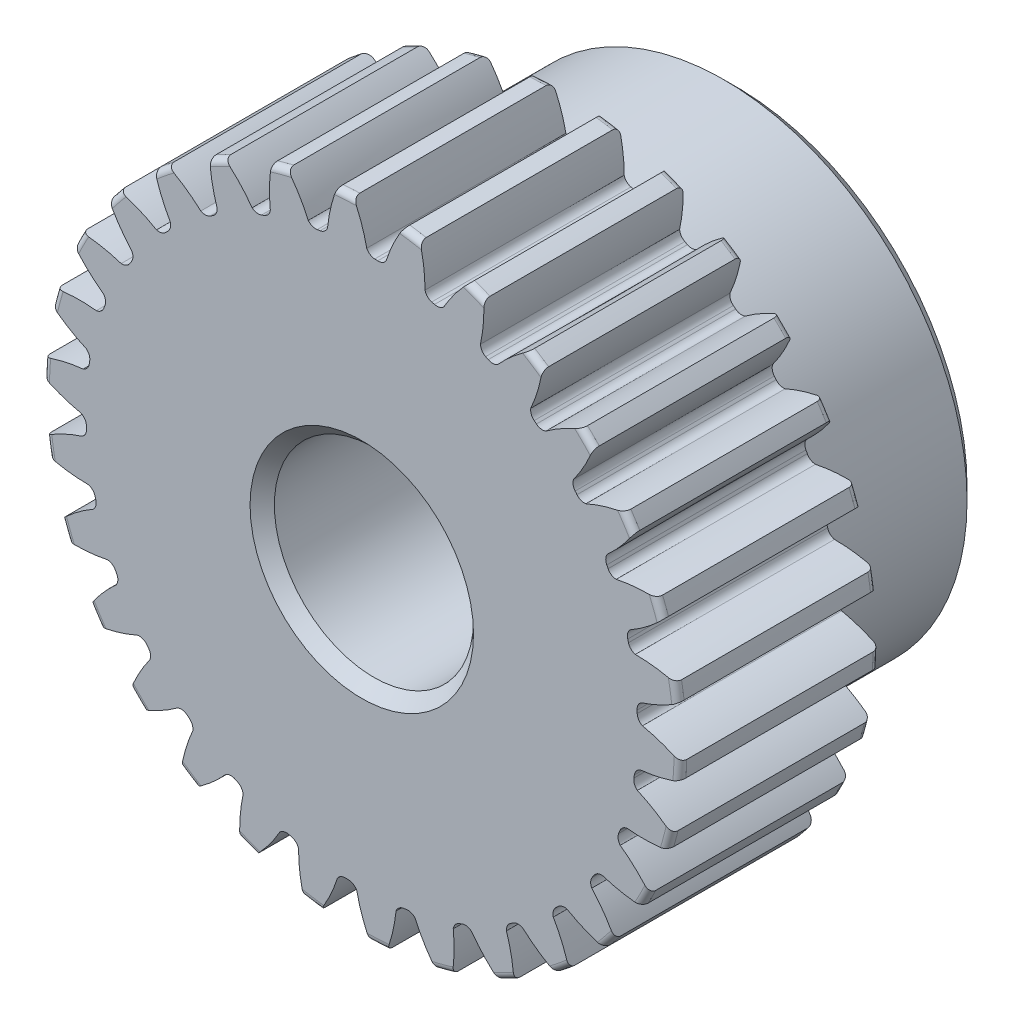
from build123d import *

# Parameters (mm, degrees)
SKETCH1_R                = 20.32
BOSS_EXTRUDE1_DEPTH      = 12.7
SKETCH2_W                = 11.176
SKETCH2_H                = 15.494
FILLET2_R                = 0.4064
CUT_EXTRUDE1_DEPTH       = 38.361319303
FILLET1_R                = 0.5984748
CIRPATTERN1_COUNT        = 30
FILLET1_OF_CIRPATTERN1_R = 0.5984748
SKETCH5_R                = 6.35
CUT_EXTRUDE2_DEPTH       = 38.353644107
CHAMFER1_SIZE            = 0.7747


with BuildPart() as part:
    # Sketch1 → Boss-Extrude1 (new body)
    with BuildSketch(Plane.XY):
        Circle(SKETCH1_R)
    extrude(amount=-BOSS_EXTRUDE1_DEPTH)

    # Sketch2 → Revolve1 (revolve)
    with BuildSketch(Plane(origin=(0, 0, 0), x_dir=(0, 0, -1), z_dir=(1, 0, 0)), mode=Mode.PRIVATE) as revolve1_sk:
        with Locations((18.288, 7.747)):
            Rectangle(SKETCH2_W, SKETCH2_H)
    revolve(revolve1_sk.sketch.rotate(Axis((0, 0, -12.7), (0, 0, -1)), 90), axis=Axis((0, 0, -12.7), (0, 0, -1)))

    # Fillet2
    fillet2_edges = [part.edges().sort_by_distance(p)[0] for p in [
        (-20.32, 0, 0),
        (-20.32, 0, -12.7),
        (-15.494, 0, -12.7),
    ]]
    fillet(fillet2_edges, radius=FILLET2_R)

    # Sketch4 → Cut-Extrude1 (cut, through all)
    with BuildSketch(Plane.XY):
        with BuildLine():
            Line((0.316235248, 17.898350958), (0.316235248, 17.577765593))
            ThreePointArc((0.316235248, 17.577765593), (0.920100185, 17.556516272), (1.522878236, 17.514527965))
            Line((1.522878236, 17.514527965), (1.556388609, 17.833357122))
            add(Edge.make_bspline(
                [(7.60274721, 24.159654156), (2.923261273, 22.051641148), (1.556388609, 17.833357122)],
                knots=[0, 0, 0, 1, 1, 1], degree=2))
            ThreePointArc((7.60274721, 24.159654156), (1.325550705, 25.292954936), (-5.035720965, 24.822009758))
            add(Edge.make_bspline(
                [(-5.035720965, 24.822009758), (-0.602217735, 22.236404106), (0.316235248, 17.898350958)],
                knots=[0, 0, 0, 1, 1, 1], degree=2))
        make_face()
    cut_extrude1 = extrude(amount=-CUT_EXTRUDE1_DEPTH, mode=Mode.SUBTRACT)

    # Fillet1
    # the kernel refuses this fillet: 0.5984748 mm, written as the material it adds along each edge
    with BuildSketch(Plane(origin=(1.522878236, 17.514527965, 0), x_dir=(0.10452870680651095, 0.9945218697712779, 0), z_dir=(0, 0, -1))) as fillet1_piece_1:
        with BuildLine():
            CenterArc((0.581202596, -0.538749242), FILLET1_R, 115.815141676, 61.489173657)
            Line((-0.016609944, -0.510602243), (-0.028566195, -0.510039303))
            ThreePointArc((-0.028566195, -0.510039303), (-0.018413353, -0.254972295), (-0.011967559, 0.000215304))
            Line((-0.011967559, 0.000215304), (0, 0.011969496))
            ThreePointArc((0, 0.011969496), (0.160292683, 0.011969496), (0.315373021, 0.010774985))
            Line((0.315373021, 0.010774985), (0.320585365, 0))
        make_face()
    extrude(amount=12.7)
    with BuildSketch(Plane(origin=(0.316235248, 17.577765593, 0), x_dir=(0, 1, 0), z_dir=(0, 0, -1))) as fillet1_piece_2:
        with BuildLine():
            CenterArc((0.581202596, 0.538749242), FILLET1_R, 182.695684668, 61.489173657)
            Line((-0.016609944, 0.510602243), (-0.028566195, 0.510039303))
            ThreePointArc((-0.028566195, 0.510039303), (-0.018413353, 0.254972295), (-0.011967559, -0.000215304))
            Line((-0.011967559, -0.000215304), (0, -0.011969496))
            ThreePointArc((0, -0.011969496), (0.160292683, -0.011969496), (0.315373021, -0.010774985))
            Line((0.315373021, -0.010774985), (0.320585365, 0))
        make_face()
    extrude(amount=12.7)

    # CirPattern1: Cut-Extrude1 ×30 about axis
    cirpattern1_axis = Axis((0, 0, -12.7), (0, 0, 1))
    for i in range(1, CIRPATTERN1_COUNT):
        add(cut_extrude1.rotate(cirpattern1_axis, i * 360 / CIRPATTERN1_COUNT), mode=Mode.SUBTRACT)

    # Fillet1 of CirPattern1
    # the kernel refuses this fillet: 0.5984748 mm, written as the material it adds along each edge
    with BuildSketch(Plane(origin=(-2.151875431, 17.448417696, 0), x_dir=(-0.9905976167849606, -0.1368077542391384, 0), z_dir=(0, 0, -1)), Plane(origin=(-5.732581815, 16.619727847, 0), x_dir=(-0.9405067506500004, -0.3397750019965827, 0), z_dir=(0, 0, -1)), Plane(origin=(-9.062746866, 15.06467614, 0), x_dir=(-0.8493112264595236, -0.5278924517454479, 0), z_dir=(0, 0, -1)), Plane(origin=(-11.996826391, 12.851225798, 0), x_dir=(-0.7209967262253384, -0.6929384682440025, 0), z_dir=(0, 0, -1)), Plane(origin=(-14.406587036, 10.076115222, 0), x_dir=(-0.5611712093289678, -0.8276997485926064, 0), z_dir=(0, 0, -1)), Plane(origin=(-16.186710696, 6.860630059, 0), x_dir=(-0.37681981778670437, -0.9262865781836608, 0), z_dir=(0, 0, -1)), Plane(origin=(-17.259397427, 3.345302442, 0), x_dir=(-0.1759995920250461, -0.9843902394919494, 0), z_dir=(0, 0, -1)), Plane(origin=(-17.57776567, -0.316230944, 0), x_dir=(0.0325126604478429, -0.9994713237059897, 0), z_dir=(0, 0, -1)), Plane(origin=(-17.127901207, -3.96394352, 0), x_dir=(0.2396039536461177, -0.9708707150785572, 0), z_dir=(0, 0, -1)), Plane(origin=(-15.929465271, -7.438412744, 0), x_dir=(0.4362234043227118, -0.8998383974476217, 0), z_dir=(0, 0, -1)), Plane(origin=(-14.034835265, -10.587787637, 0), x_dir=(0.613777798998263, -0.7894788239445361, 0), z_dir=(0, 0, -1)), Plane(origin=(-11.526815612, -13.274425405, 0), x_dir=(0.7645071586249542, -0.6446152374953598, 0), z_dir=(0, 0, -1)), Plane(origin=(-8.515018804, -15.380907084, 0), x_dir=(0.8818238869073721, -0.4715788719605388, 0), z_dir=(0, 0, -1)), Plane(origin=(-5.131074816, -16.815169318, 0), x_dir=(0.9606006798714525, -0.27793224683455375, 0), z_dir=(0, 0, -1)), Plane(origin=(-1.522878236, -17.514527965, 0), x_dir=(0.9973946136516743, -0.07213864885501729, 0), z_dir=(0, 0, -1)), Plane(origin=(2.151875431, -17.448417696, 0), x_dir=(0.9905976167849604, 0.13680775423913874, 0), z_dir=(0, 0, -1)), Plane(origin=(5.732581815, -16.619727847, 0), x_dir=(0.9405067506499983, 0.33977500199658894, 0), z_dir=(0, 0, -1)), Plane(origin=(9.062746866, -15.06467614, 0), x_dir=(0.849311226459524, 0.5278924517454472, 0), z_dir=(0, 0, -1)), Plane(origin=(11.996826391, -12.851225798, 0), x_dir=(0.7209967262253383, 0.6929384682440025, 0), z_dir=(0, 0, -1)), Plane(origin=(14.406587036, -10.076115222, 0), x_dir=(0.5611712093289655, 0.827699748592608, 0), z_dir=(0, 0, -1)), Plane(origin=(16.186710696, -6.860630059, 0), x_dir=(0.37681981778670437, 0.9262865781836608, 0), z_dir=(0, 0, -1)), Plane(origin=(17.259397427, -3.345302442, 0), x_dir=(0.1759995920250461, 0.9843902394919494, 0), z_dir=(0, 0, -1)), Plane(origin=(17.57776567, 0.316230944, 0), x_dir=(-0.03251266044784959, 0.9994713237059895, 0), z_dir=(0, 0, -1)), Plane(origin=(17.127901207, 3.96394352, 0), x_dir=(-0.2396039536461177, 0.9708707150785572, 0), z_dir=(0, 0, -1)), Plane(origin=(15.929465271, 7.438412744, 0), x_dir=(-0.4362234043227103, 0.8998383974476223, 0), z_dir=(0, 0, -1)), Plane(origin=(14.034835265, 10.587787637, 0), x_dir=(-0.613777798998264, 0.7894788239445353, 0), z_dir=(0, 0, -1)), Plane(origin=(11.526815612, 13.274425405, 0), x_dir=(-0.76450715862496, 0.6446152374953529, 0), z_dir=(0, 0, -1)), Plane(origin=(8.515018804, 15.380907084, 0), x_dir=(-0.8818238869073727, 0.47157887196053755, 0), z_dir=(0, 0, -1)), Plane(origin=(5.131074816, 16.815169318, 0), x_dir=(-0.960600679871451, 0.27793224683455875, 0), z_dir=(0, 0, -1))) as fillet1_of_cirpattern1_piece_1:
        with BuildLine():
            CenterArc((0.519567828, 0.598411626), FILLET1_OF_CIRPATTERN1_R, 207.678322279, 61.489173657)
            Line((-0.010423162, 0.320415877), (-0.021022981, 0.314855962))
            ThreePointArc((-0.021022981, 0.314855962), (-0.017174749, 0.159818775), (-0.011963168, -0.000389163))
            Line((-0.011963168, -0.000389163), (0.00017391, -0.011968233))
            ThreePointArc((0.00017391, -0.011968233), (0.255436167, -0.010113728), (0.510698423, -0.011968233))
            Line((0.510698423, -0.011968233), (0.510872333, 0))
        make_face()
    extrude(amount=12.7)
    with BuildSketch(Plane(origin=(-3.345298216, 17.259398246, 0), x_dir=(-0.20791169081776292, 0.9781476007338049, 0), z_dir=(0, 0, -1)), Plane(origin=(-6.860626095, 16.186712376, 0), x_dir=(-0.40673664307580226, 0.9135454576425999, 0), z_dir=(0, 0, -1)), Plane(origin=(-10.076111694, 14.406589503, 0), x_dir=(-0.5877852522924729, 0.8090169943749476, 0), z_dir=(0, 0, -1)), Plane(origin=(-12.85122286, 11.996829538, 0), x_dir=(-0.7431448254773939, 0.6691306063588587, 0), z_dir=(0, 0, -1)), Plane(origin=(-15.064673921, 9.062750555, 0), x_dir=(-0.8660254037844389, 0.49999999999999956, 0), z_dir=(0, 0, -1)), Plane(origin=(-16.619726443, 5.732585885, 0), x_dir=(-0.9510565162951523, 0.30901699437495134, 0), z_dir=(0, 0, -1)), Plane(origin=(-17.448417169, 2.151879704, 0), x_dir=(-0.9945218953682733, 0.10452846326765322, 0), z_dir=(0, 0, -1)), Plane(origin=(-17.514528338, -1.522873947, 0), x_dir=(-0.9945218953682726, -0.10452846326766077, 0), z_dir=(0, 0, -1)), Plane(origin=(-16.815170575, -5.131070698, 0), x_dir=(-0.9510565162951548, -0.30901699437494384, 0), z_dir=(0, 0, -1)), Plane(origin=(-15.380909169, -8.515015038, 0), x_dir=(-0.8660254037844403, -0.49999999999999717, 0), z_dir=(0, 0, -1)), Plane(origin=(-13.274428227, -11.526812361, 0), x_dir=(-0.7431448254773964, -0.6691306063588559, 0), z_dir=(0, 0, -1)), Plane(origin=(-10.587791074, -14.034832673, 0), x_dir=(-0.5877852522924729, -0.8090169943749476, 0), z_dir=(0, 0, -1)), Plane(origin=(-7.438416645, -15.92946345, 0), x_dir=(-0.4067366430758002, -0.9135454576426009, 0), z_dir=(0, 0, -1)), Plane(origin=(-3.963947715, -17.127900236, 0), x_dir=(-0.2079116908177603, -0.9781476007338055, 0), z_dir=(0, 0, -1)), Plane(origin=(-0.316235248, -17.577765593, 0), x_dir=(0, -1, 0), z_dir=(0, 0, -1)), Plane(origin=(3.345298216, -17.259398246, 0), x_dir=(0.20791169081775362, -0.9781476007338068, 0), z_dir=(0, 0, -1)), Plane(origin=(6.860626095, -16.186712376, 0), x_dir=(0.4067366430757954, -0.9135454576426031, 0), z_dir=(0, 0, -1)), Plane(origin=(10.076111694, -14.406589503, 0), x_dir=(0.5877852522924729, -0.8090169943749476, 0), z_dir=(0, 0, -1)), Plane(origin=(12.85122286, -11.996829538, 0), x_dir=(0.7431448254773939, -0.6691306063588587, 0), z_dir=(0, 0, -1)), Plane(origin=(15.064673921, -9.062750555, 0), x_dir=(0.8660254037844414, -0.4999999999999954, 0), z_dir=(0, 0, -1)), Plane(origin=(16.619726443, -5.732585885, 0), x_dir=(0.9510565162951523, -0.30901699437495134, 0), z_dir=(0, 0, -1)), Plane(origin=(17.448417169, -2.151879704, 0), x_dir=(0.9945218953682736, -0.10452846326765071, 0), z_dir=(0, 0, -1)), Plane(origin=(17.514528338, 1.522873947, 0), x_dir=(0.9945218953682733, 0.10452846326765344, 0), z_dir=(0, 0, -1)), Plane(origin=(16.815170575, 5.131070698, 0), x_dir=(0.9510565162951548, 0.30901699437494384, 0), z_dir=(0, 0, -1)), Plane(origin=(15.380909169, 8.515015038, 0), x_dir=(0.8660254037844427, 0.499999999999993, 0), z_dir=(0, 0, -1)), Plane(origin=(13.274428227, 11.526812361, 0), x_dir=(0.7431448254773964, 0.6691306063588559, 0), z_dir=(0, 0, -1)), Plane(origin=(10.587791074, 14.034832673, 0), x_dir=(0.5877852522924693, 0.8090169943749502, 0), z_dir=(0, 0, -1)), Plane(origin=(7.438416645, 15.92946345, 0), x_dir=(0.40673664307579843, 0.9135454576426016, 0), z_dir=(0, 0, -1)), Plane(origin=(3.963947715, 17.127900236, 0), x_dir=(0.20791169081775762, 0.9781476007338059, 0), z_dir=(0, 0, -1))) as fillet1_of_cirpattern1_piece_2:
        with BuildLine():
            CenterArc((0.581202596, 0.538749242), FILLET1_OF_CIRPATTERN1_R, 182.695684668, 61.489173657)
            Line((-0.016609944, 0.510602243), (-0.028566195, 0.510039303))
            ThreePointArc((-0.028566195, 0.510039303), (-0.018413353, 0.254972295), (-0.011967559, -0.000215304))
            Line((-0.011967559, -0.000215304), (0, -0.011969496))
            ThreePointArc((0, -0.011969496), (0.160292683, -0.011969496), (0.315373021, -0.010774985))
            Line((0.315373021, -0.010774985), (0.320585365, 0))
        make_face()
    extrude(amount=12.7)

    # Sketch5 → Cut-Extrude2 (cut, through all)
    with BuildSketch(Plane.XY):
        Circle(SKETCH5_R)
    extrude(amount=-CUT_EXTRUDE2_DEPTH, mode=Mode.SUBTRACT)

    # Chamfer1
    chamfer1_edges = [part.edges().sort_by_distance(p)[0] for p in [
        (-6.35, 0, -23.876),
        (-6.35, 0, 0),
        (-15.494, 0, -23.876),
    ]]
    chamfer(chamfer1_edges, length=CHAMFER1_SIZE)


solid = part.part
